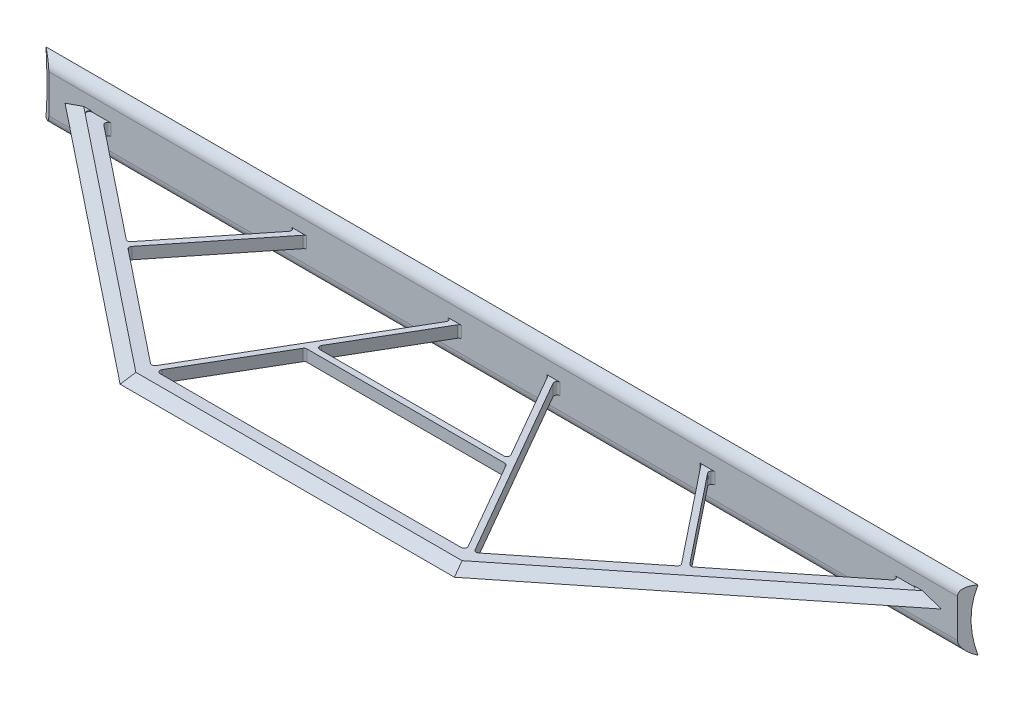
from build123d import *

# Parameters (mm, degrees)
BOSS_EXTRUDE3_DEPTH      = 254
BOSS_EXTRUDE3_DEPTH_BACK = 254
CUT_EXTRUDE1_START       = -508
CUT_EXTRUDE1_DEPTH       = 508
CUT_EXTRUDE2_DEPTH       = 68.58
CUT_EXTRUDE3_DEPTH       = 68.834
BOSS_EXTRUDE4_DEPTH      = 0.381
BOSS_EXTRUDE4_DEPTH_BACK = 6.731
BOSS_EXTRUDE5_DEPTH      = 0.381
BOSS_EXTRUDE5_DEPTH_BACK = 6.731
BOSS_EXTRUDE6_DEPTH      = 6.35
BOSS_EXTRUDE7_DEPTH      = 1.2701
BOSS_EXTRUDE7_DEPTH_BACK = 110.49
BOSS_EXTRUDE9_DEPTH      = 6.35
FILLET1_R                = 6.35


with BuildPart() as part:
    # Sweep2: sweep along a path in CS path
    with BuildLine(Plane(origin=(0, 0, 0), x_dir=(1, 0, 0), z_dir=(0, 1, 0))) as sweep2_path:
        Line((248.466017094, 15.827234907), (88.9, -111.298842947))
        Line((88.9, -111.298842947), (-88.9, -111.298842947))
        Line((-88.9, -111.298842947), (-248.466017094, 15.827234907))
    # Sketch7 → Sweep2 (sweep)
    with BuildSketch(Plane(origin=(248.466017094, 0, -15.827234907), x_dir=(-0.6231194845416403, 0, -0.7821266572522385), z_dir=(0.7821266572522386, 0, -0.6231194845416403))):
        Polygon((0, 3.175), (0, 3.556), (-6.35, 0), (0, -3.556), (0, -3.175), (6.35, -3.175), (6.35, 3.175), align=None)
    sweep(path=sweep2_path.line, transition=Transition.RIGHT)



with BuildPart() as body_2:
    # Sketch8 → Boss-Extrude3 (new, two sides: drawn at the far end of the back side and taken through both)
    with BuildSketch(Plane(origin=(0, 0, 0), x_dir=(0, 0, -1), z_dir=(1, 0, 0)).offset(-BOSS_EXTRUDE3_DEPTH_BACK)):
        with BuildLine():
            Line((4.829932897, 16.573899603), (0, 17.600533533))
            Line((0, 17.600533533), (0, -17.600533533))
            Line((0, -17.600533533), (4.829932897, -16.573899603))
            ThreePointArc((4.829932897, -16.573899603), (3.175, 0), (4.829932897, 16.573899603))
        make_face()
    extrude(amount=BOSS_EXTRUDE3_DEPTH + BOSS_EXTRUDE3_DEPTH_BACK)


with BuildPart() as part_1:
    add(part.part)

    add(body_2.part)  # Sweep3 merges body 2
    # Sweep3: sweep along a path in Sketch11
    with BuildLine(Plane(origin=(0, 0, 0), x_dir=(1, 0, 0), z_dir=(0, 1, 0))) as sweep3_path:
        Line((-89.138825221, -109.160343039), (-15.091285359, 17.654903783))
    # Sketch12 → Sweep3 (sweep)
    with BuildSketch(Plane(origin=(-15.091285359, 0, -17.654903783), x_dir=(-0.8635654930080803, 0, -0.5042366897457098), z_dir=(0.5042366897457098, 0, -0.8635654930080803))):
        Polygon((0, -3.175), (1.5875, -3.175), (1.5875, 3.175), (-1.5875, 3.175), (-1.5875, -3.175), align=None)
    sweep(path=sweep3_path.line)

    # Sweep5: sweep along a path in Sketch13
    with BuildLine(Plane(origin=(0, 0, 0), x_dir=(1, 0, 0), z_dir=(0, 1, 0))) as sweep5_path:
        Line((89.843399112, -110.454628552), (12.634277531, 23.91352897))
    # Sketch14 → Sweep5 (sweep)
    with BuildSketch(Plane(origin=(12.634277531, 0, -23.91352897), x_dir=(-0.8670528510827185, 0, 0.49821617138480095), z_dir=(-0.498216171384801, 0, -0.8670528510827186))):
        Polygon((0, -3.175), (1.5875, -3.175), (1.5875, 3.175), (-1.5875, 3.175), (-1.5875, -3.175), align=None)
    sweep(path=sweep5_path.line)

    # Sketch15 → Cut-Extrude1 (cut)
    with BuildSketch(Plane(origin=(254, 0, 0), x_dir=(0, 0, -1), z_dir=(1, 0, 0)).offset(CUT_EXTRUDE1_START)):
        with BuildLine():
            Line((4.829932897, -16.573899603), (30.949901181, -16.573899603))
            Line((30.949901181, -16.573899603), (30.949901181, 16.573899603))
            Line((30.949901181, 16.573899603), (4.829932897, 16.573899603))
            ThreePointArc((4.829932897, 16.573899603), (3.175, 0), (4.829932897, -16.573899603))
        make_face()
    extrude(amount=CUT_EXTRUDE1_DEPTH, mode=Mode.SUBTRACT)

    # Sketch17 → Cut-Extrude2 (cut)
    with BuildSketch(Plane.XZ.offset(-17.600533533)):
        Polygon((254, 0), (247.65, 0), (254, -4.829932897), align=None)
    extrude(amount=CUT_EXTRUDE2_DEPTH, mode=Mode.SUBTRACT)

    # Sketch18 → Cut-Extrude3 (cut)
    with BuildSketch(Plane.XZ.offset(-17.600533533)):
        Polygon((-254, 0), (-247.65, 0), (-254, -4.829932897), align=None)
    extrude(amount=CUT_EXTRUDE3_DEPTH, mode=Mode.SUBTRACT)

    # Sketch19 → Boss-Extrude4 (add, two sides: drawn at the far end of the back side and taken through both)
    with BuildSketch(Plane(origin=(0, 3.175, 0), x_dir=(1, 0, 0), z_dir=(0, 1, 0)).offset(-BOSS_EXTRUDE4_DEPTH_BACK)):
        with BuildLine():
            Line((223.878126934, 0), (228.6, 0))
            Line((228.6, 0), (224.906897203, -2.942291111))
            ThreePointArc((224.906897203, -2.942291111), (225.436607383, -1.106078274), (223.878126934, 0))
        make_face()
    extrude(amount=BOSS_EXTRUDE4_DEPTH + BOSS_EXTRUDE4_DEPTH_BACK)

    # Sketch20 → Boss-Extrude5 (add, two sides: drawn at the far end of the back side and taken through both)
    with BuildSketch(Plane.XZ.offset(3.175).offset(-BOSS_EXTRUDE5_DEPTH_BACK)):
        with BuildLine():
            Line((-224.906897203, 2.942291111), (-228.6, 0))
            Line((-228.6, 0), (-223.878126934, 0))
            ThreePointArc((-223.878126934, 0), (-225.436607383, 1.106078274), (-224.906897203, 2.942291111))
        make_face()
    extrude(amount=BOSS_EXTRUDE5_DEPTH + BOSS_EXTRUDE5_DEPTH_BACK)

    # Sketch21 → Boss-Extrude6 (add)
    with BuildSketch(Plane(origin=(0, 3.175, 0), x_dir=(1, 0, 0), z_dir=(0, 1, 0))):
        with BuildLine():
            Line((-89.426759305, -102.760284742), (-87.934379177, -103.949262419))
            Line((-87.934379177, -103.949262419), (-86.972242407, -102.301488406))
            ThreePointArc((-86.972242407, -102.301488406), (-88.094639276, -103.091886087), (-89.426759305, -102.760284742))
        make_face()
        with BuildLine():
            ThreePointArc((-81.965556152, -104.948842947), (-83.397381887, -104.11983812), (-83.391302781, -102.465348173))
            Line((-83.391302781, -102.465348173), (-84.841417676, -104.948842947))
            Line((-84.841417676, -104.948842947), (-81.965556152, -104.948842947))
        make_face()
        with BuildLine():
            Line((-218.409338084, 0), (-214.716235287, -2.942291111))
            ThreePointArc((-214.716235287, -2.942291111), (-215.245945468, -1.106078274), (-213.687465018, 0))
            Line((-213.687465018, 0), (-218.409338084, 0))
        make_face()
        with BuildLine():
            ThreePointArc((-30.114170272, 0), (-28.682344536, -0.829004828), (-28.688423643, -2.483494775))
            Line((-28.688423643, -2.483494775), (-27.238308748, 0))
            Line((-27.238308748, 0), (-30.114170272, 0))
        make_face()
        with BuildLine():
            Line((-22.613870581, 0), (-23.561691252, 0))
            Line((-23.561691252, 0), (-24.03961721, -0.818505225))
            ThreePointArc((-24.03961721, -0.818505225), (-23.435865753, -0.219174265), (-22.613870581, 0))
        make_face()
        with BuildLine():
            Line((31.058946485, 0), (28.206115892, 0))
            Line((28.206115892, 0), (29.627442228, -2.473554899))
            ThreePointArc((29.627442228, -2.473554899), (29.629988973, -0.824028761), (31.058946485, 0))
        make_face()
        with BuildLine():
            Line((24.544286055, 0), (23.588813618, 0))
            ThreePointArc((23.588813618, 0), (24.415784857, -0.222042489), (25.020317875, -0.828445101))
            Line((25.020317875, -0.828445101), (24.544286055, 0))
        make_face()
        with BuildLine():
            Line((84.848811505, -104.948842947), (83.42748517, -102.475288048))
            ThreePointArc((83.42748517, -102.475288048), (83.424938424, -104.124814187), (81.995980913, -104.948842947))
            Line((81.995980913, -104.948842947), (84.848811505, -104.948842947))
        make_face()
        with BuildLine():
            ThreePointArc((213.687465018, 0), (215.245945468, -1.106078274), (214.716235287, -2.942291111))
            Line((214.716235287, -2.942291111), (218.409338084, 0))
            Line((218.409338084, 0), (213.687465018, 0))
        make_face()
        with BuildLine():
            ThreePointArc((86.978319053, -102.282120176), (88.100829661, -103.081392618), (89.438593579, -102.750856388))
            Line((89.438593579, -102.750856388), (87.935678698, -103.948227093))
            Line((87.935678698, -103.948227093), (86.978319053, -102.282120176))
        make_face()
    extrude(amount=-BOSS_EXTRUDE6_DEPTH)

    # Sweep6: sweep along a path in Sketch22
    with BuildLine(Plane(origin=(0, 3.175, 0), x_dir=(1, 0, 0), z_dir=(0, 1, 0))) as sweep6_path:
        Line((-152.071497255, -52.85128796), (-108.200975455, 2.214081393))
    # Sketch23 → Sweep6 (sweep)
    with BuildSketch(Plane(origin=(-152.071497255, 3.175, 52.85128796), x_dir=(-0.7821266572522384, 0, -0.6231194845416403), z_dir=(0.6231194845416403, 0, -0.7821266572522384))):
        Polygon((0, -6.35), (1.5875, -6.35), (1.5875, 0), (-1.5875, 0), (-1.5875, -6.35), align=None)
    sweep(path=sweep6_path.line)

    # Sweep7: sweep along a path in Sketch24
    with BuildLine(Plane(origin=(0, 3.175, 0), x_dir=(1, 0, 0), z_dir=(0, 1, 0))) as sweep7_path:
        Line((152.077414419, -52.846573761), (109.974604732, 0))
    # Sketch25 → Sweep7 (sweep)
    with BuildSketch(Plane(origin=(152.077414419, 3.175, 52.846573761), x_dir=(-0.7821266572522393, 0, 0.6231194845416392), z_dir=(-0.6231194845416392, 0, -0.7821266572522393))):
        Polygon((1.5875, 0), (0, 0), (-1.5875, 0), (-1.5875, -6.35), (0, -6.35), (1.5875, -6.35), align=None)
    sweep(path=sweep7_path.line)

    # Sketch27 → Boss-Extrude7 (add, two sides: drawn at the far end of the back side and taken through both)
    with BuildSketch(Plane(origin=(54.223901551, 3.175, 51.651866625), x_dir=(9.208844186523149e-05, 0, -0.9999999957598595), z_dir=(0.9999999957598595, 0, 9.208844186523149e-05)).offset(-BOSS_EXTRUDE7_DEPTH_BACK)):
        Polygon((0, -6.35), (1.5875, -6.35), (1.5875, 0), (-1.5875, 0), (-1.5875, -6.35), align=None)
    extrude(amount=BOSS_EXTRUDE7_DEPTH + BOSS_EXTRUDE7_DEPTH_BACK)

    # Sketch28 → Boss-Extrude9 (add)
    with BuildSketch(Plane(origin=(0, 3.175, 0), x_dir=(1, 0, 0), z_dir=(0, 1, 0))):
        with BuildLine():
            ThreePointArc((107.149320987, 0), (107.866015234, -0.163670058), (108.440612098, -0.622229731))
            Line((108.440612098, -0.622229731), (107.944882327, 0))
            Line((107.944882327, 0), (107.149320987, 0))
        make_face()
        Polygon((108.440612098, -0.622229731), (108.732978664, -0.989202182), (109.974604732, 0), (107.944882327, 0), align=None)
        with BuildLine():
            Line((112.004327137, 0), (114.13929729, -2.679770269))
            ThreePointArc((114.13929729, -2.679770269), (113.943258459, -0.934305754), (115.430588401, 0))
            Line((115.430588401, 0), (112.004327137, 0))
        make_face()
        with BuildLine():
            Line((152.290270219, -50.566080468), (153.319040488, -51.857371579))
            Line((153.319040488, -51.857371579), (154.610331599, -50.82860131))
            ThreePointArc((154.610331599, -50.82860131), (153.395931062, -51.177841334), (152.290270219, -50.566080468))
        make_face()
        with BuildLine():
            Line((150.835788351, -53.835775943), (149.807018082, -52.544484832))
            ThreePointArc((149.807018082, -52.544484832), (150.156258105, -53.758885368), (149.54449724, -54.864546212))
            Line((149.54449724, -54.864546212), (150.835788351, -53.835775943))
        make_face()
        with BuildLine():
            ThreePointArc((51.890184551, -47.590464979), (51.887599727, -49.240056912), (50.458528256, -50.064019871))
            Line((50.458528256, -50.064019871), (53.311661856, -50.064282612))
            Line((53.311661856, -50.064282612), (51.890184551, -47.590464979))
        make_face()
        with BuildLine():
            Line((55.136141247, -53.239450638), (54.18077029, -53.23936266))
            ThreePointArc((54.18077029, -53.23936266), (55.007655286, -53.46144322), (55.612122509, -54.067807754))
            Line((55.612122509, -54.067807754), (55.136141247, -53.239450638))
        make_face()
        with BuildLine():
            Line((-51.338606818, -47.571282044), (-52.788567089, -50.054512007))
            Line((-52.788567089, -50.054512007), (-49.913012227, -50.054776812))
            ThreePointArc((-49.913012227, -50.054776812), (-51.344723771, -49.225706063), (-51.338606818, -47.571282044))
        make_face()
        with BuildLine():
            Line((-54.642352853, -53.229341308), (-55.120329777, -54.047933819))
            ThreePointArc((-55.120329777, -54.047933819), (-54.516512392, -53.448565012), (-53.69443111, -53.229428601))
            Line((-53.69443111, -53.229428601), (-54.642352853, -53.229341308))
        make_face()
        with BuildLine():
            ThreePointArc((-115.420915439, 0), (-113.933585497, -0.934305754), (-114.129624328, -2.679770269))
            Line((-114.129624328, -2.679770269), (-111.994654175, 0))
            Line((-111.994654175, 0), (-115.420915439, 0))
        make_face()
        with BuildLine():
            Line((-107.139648025, 0), (-107.935209365, 0))
            Line((-107.935209365, 0), (-108.430939137, -0.622229731))
            ThreePointArc((-108.430939137, -0.622229731), (-107.856342272, -0.163670058), (-107.139648025, 0))
        make_face()
        with BuildLine():
            ThreePointArc((-149.538580075, -54.86926041), (-150.150340941, -53.763599567), (-149.801100917, -52.54919903))
            Line((-149.801100917, -52.54919903), (-150.829871186, -53.840490141))
            Line((-150.829871186, -53.840490141), (-149.538580075, -54.86926041))
        make_face()
        with BuildLine():
            Line((-154.604414434, -50.833315509), (-153.313123323, -51.862085778))
            Line((-153.313123323, -51.862085778), (-152.284353054, -50.570794667))
            ThreePointArc((-152.284353054, -50.570794667), (-153.390013898, -51.182555533), (-154.604414434, -50.833315509))
        make_face()
    extrude(amount=-BOSS_EXTRUDE9_DEPTH)

    # Fillet1
    # the kernel refuses this fillet: 6.35 mm, written as the material it takes off along each edge
    with BuildSketch(Plane(origin=(-265.630031876, -17.600533533, 0), x_dir=(0, 1, 0), z_dir=(1, 0, 0))) as fillet1_piece_1:
        with BuildLine():
            CenterArc((7.192012751, -6.35), FILLET1_R, 90, 76.150011514)
            Line((1.02663393, -4.829932897), (0.903326353, -4.799531555))
            ThreePointArc((0.903326353, -4.799531555), (0.38909222, -2.441371233), (-0.124224745, -0.026404785))
            Line((-0.124224745, -0.026404785), (0, 0.127))
            Line((0, 0.127), (7.192012751, 0.127))
            Line((7.192012751, 0.127), (7.192012751, 0))
        make_face()
    extrude(amount=531.260063753, mode=Mode.SUBTRACT)
    with BuildSketch(Plane(origin=(-265.630031876, 17.600533533, 0), x_dir=(0, -0.2079116908183426, -0.9781476007336817), z_dir=(1, 0, 0))) as fillet1_piece_2:
        with BuildLine():
            CenterArc((7.706540796, -5.71461078), FILLET1_R, 115.849988486, 76.150011514)
            Line((1.495303531, -7.034850016), (1.371078786, -7.061254801))
            Line((1.371078786, -7.061254801), (-0.124224745, -0.026404785))
            Line((-0.124224745, -0.026404785), (0, 0.127))
            ThreePointArc((0, 0.127), (2.468918236, 0.127), (4.882462385, 0.114292216))
            Line((4.882462385, 0.114292216), (4.937836472, 0))
        make_face()
    extrude(amount=531.260063753, mode=Mode.SUBTRACT)


solid = part_1.part
